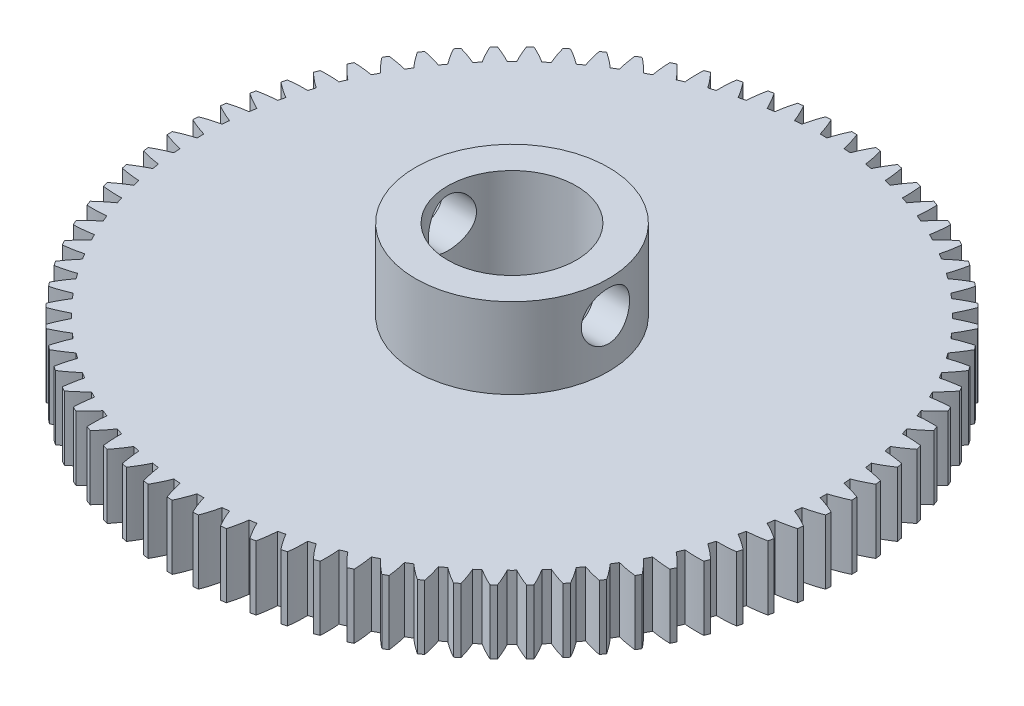
from build123d import *

# Parameters (mm, degrees)
SKETCH_1_R               = 0.4
EXTRUDE_1_DEPTH          = 4
SKETCH_2_R               = 6
EXTRUDE_2_DEPTH          = 5
SKETCH_3_R               = 4
CUT_EXTRUDE_1_DEPTH      = 31.342722335
CUT_EXTRUDE_3_DEPTH      = 31.342722335
CUT_EXTRUDE_3_DEPTH_BACK = 31.342722335
SKETCH_5_R               = 1.5


with BuildPart() as part:
    # ｽｹｯﾁ1 → ﾎﾞｽ - 押し出し1 (new body)
    with BuildSketch(Plane(origin=(0, 0, 0), x_dir=(1, 0, 0), z_dir=(0, 1, 0))):
        with BuildLine():
            ThreePointArc((-20.490007305, 0.640000509), (-19.939485125, 0.404140641), (-19.372860459, 0.210127665))
            ThreePointArc((-19.372860459, 0.210127665), (-19.374, 0), (-19.372860459, -0.210127665))
            ThreePointArc((-19.372860459, -0.210127665), (-19.939485125, -0.404140641), (-20.490007305, -0.640000509))
            ThreePointArc((-20.490007305, -0.640000509), (-20.484195243, -0.804826223), (-20.477057312, -0.969599844))
            ThreePointArc((-20.477057312, -0.969599844), (-19.909726856, -1.161539162), (-19.329626822, -1.310497202))
            ThreePointArc((-19.329626822, -1.310497202), (-19.314276424, -1.520066521), (-19.296653969, -1.729457025))
            ThreePointArc((-19.296653969, -1.729457025), (-19.846309838, -1.967328783), (-20.376629589, -2.245655045))
            ThreePointArc((-20.376629589, -2.245655045), (-20.357903368, -2.409516648), (-20.337859451, -2.573222291))
            ThreePointArc((-20.337859451, -2.573222291), (-19.757218501, -2.720057689), (-19.167219608, -2.823042418))
            ThreePointArc((-19.167219608, -2.823042418), (-19.135473911, -3.030761326), (-19.101477191, -3.238123707))
            ThreePointArc((-19.101477191, -3.238123707), (-19.630775451, -3.518387688), (-20.137623176, -3.837464372))
            ThreePointArc((-20.137623176, -3.837464372), (-20.106098248, -3.999351601), (-20.073271924, -4.160979967))
            ThreePointArc((-20.073271924, -4.160979967), (-19.482900323, -4.261806157), (-18.886640112, -4.318182638))
            ThreePointArc((-18.886640112, -4.318182638), (-18.838694838, -4.522770479), (-18.788533453, -4.726826279))
            ThreePointArc((-18.788533453, -4.726826279), (-19.294210805, -5.047754563), (-19.77446162, -5.405614455))
            ThreePointArc((-19.77446162, -5.405614455), (-19.730332347, -5.564529222), (-19.684926, -5.723083818))
            ThreePointArc((-19.684926, -5.723083818), (-19.088463586, -5.777279172), (-18.489618198, -5.786699827))
            ThreePointArc((-18.489618198, -5.786699827), (-18.425768947, -5.986895249), (-18.359752159, -6.186386396))
            ThreePointArc((-18.359752159, -6.186386396), (-18.838690934, -6.546000353), (-19.289383933, -6.940437126))
            ThreePointArc((-19.289383933, -6.940437126), (-19.232922387, -7.09539967), (-19.175215961, -7.249902954))
            ThreePointArc((-19.175215961, -7.249902954), (-18.576340124, -7.257133341), (-17.97860164, -7.219540087))
            ThreePointArc((-17.97860164, -7.219540087), (-17.899242063, -7.414108819), (-17.817776888, -7.607805384))
            ThreePointArc((-17.817776888, -7.607805384), (-18.267024268, -8.003887874), (-18.685380779, -8.432469696))
            ThreePointArc((-18.685380779, -8.432469696), (-18.616935064, -8.58252462), (-18.54728434, -8.732024027))
            ThreePointArc((-18.54728434, -8.732024027), (-17.949687347, -8.692244869), (-17.356741025, -8.607869481))
            ThreePointArc((-17.356741025, -8.607869481), (-17.2623604, -8.795611942), (-17.165949098, -8.982319721))
            ThreePointArc((-17.165949098, -8.982319721), (-17.582735324, -9.412428765), (-17.966176038, -9.872513285))
            ThreePointArc((-17.966176038, -9.872513285), (-17.886168145, -10.016735451), (-17.805002543, -10.160309269))
            ThreePointArc((-17.805002543, -10.160309269), (-17.212368779, -10.073765816), (-16.627870329, -9.943128498))
            ThreePointArc((-16.627870329, -9.943128498), (-16.519050544, -10.122887193), (-16.408287523, -10.301455071))
            ThreePointArc((-16.408287523, -10.301455071), (-16.790042969, -10.762938902), (-17.136203849, -11.251689547))
            ThreePointArc((-17.136203849, -11.251689547), (-17.045127052, -11.389189777), (-16.952946985, -11.525952825))
            ThreePointArc((-16.952946985, -11.525952825), (-16.368930234, -11.393178648), (-15.796483284, -11.217084821))
            ThreePointArc((-15.796483284, -11.217084821), (-15.673895249, -11.387751478), (-15.549463399, -11.557078524))
            ThreePointArc((-15.549463399, -11.557078524), (-15.893834417, -12.047091942), (-16.200581264, -12.561495401))
            ThreePointArc((-16.200581264, -12.561495401), (-16.098997083, -12.691425961), (-15.996370871, -12.820535049))
            ThreePointArc((-15.996370871, -12.820535049), (-15.424571791, -12.642348745), (-14.867705666, -12.421884086))
            ThreePointArc((-14.867705666, -12.421884086), (-14.732105178, -12.582406488), (-14.594771662, -12.741448746))
            ThreePointArc((-14.594771662, -12.741448746), (-14.89963509, -13.256970654), (-15.165076708, -13.793855459))
            ThreePointArc((-15.165076708, -13.793855459), (-15.053611444, -13.915415284), (-14.941171812, -14.036074412))
            ThreePointArc((-14.941171812, -14.036074412), (-14.385115733, -13.813574558), (-13.847263698, -13.550098305))
            ThreePointArc((-13.847263698, -13.550098305), (-13.699486779, -13.699486779), (-13.550098305, -13.847263698))
            ThreePointArc((-13.550098305, -13.847263698), (-13.813574558, -14.385115733), (-14.036074412, -14.941171812))
            ThreePointArc((-14.036074412, -14.941171812), (-13.915415284, -15.053611444), (-13.793855459, -15.165076708))
            ThreePointArc((-13.793855459, -15.165076708), (-13.256970654, -14.89963509), (-12.741448746, -14.594771662))
            ThreePointArc((-12.741448746, -14.594771662), (-12.582406488, -14.732105178), (-12.421884086, -14.867705666))
            ThreePointArc((-12.421884086, -14.867705666), (-12.642348745, -15.424571791), (-12.82053505, -15.996370871))
            ThreePointArc((-12.82053505, -15.996370871), (-12.691425961, -16.098997083), (-12.561495401, -16.200581264))
            ThreePointArc((-12.561495401, -16.200581264), (-12.047091942, -15.893834417), (-11.557078524, -15.549463399))
            ThreePointArc((-11.557078524, -15.549463399), (-11.387751478, -15.673895249), (-11.217084821, -15.796483284))
            ThreePointArc((-11.217084821, -15.796483284), (-11.393178648, -16.368930234), (-11.525952825, -16.952946985))
            ThreePointArc((-11.525952825, -16.952946985), (-11.389189777, -17.045127052), (-11.251689547, -17.136203849))
            ThreePointArc((-11.251689547, -17.136203849), (-10.762938902, -16.790042969), (-10.301455071, -16.408287523))
            ThreePointArc((-10.301455071, -16.408287523), (-10.122887193, -16.519050544), (-9.943128498, -16.627870329))
            ThreePointArc((-9.943128498, -16.627870329), (-10.073765816, -17.212368779), (-10.160309269, -17.805002543))
            ThreePointArc((-10.160309269, -17.805002543), (-10.016735451, -17.886168145), (-9.872513285, -17.966176039))
            ThreePointArc((-9.872513285, -17.966176039), (-9.412428765, -17.582735324), (-8.982319722, -17.165949098))
            ThreePointArc((-8.982319722, -17.165949098), (-8.795611942, -17.2623604), (-8.607869481, -17.356741025))
            ThreePointArc((-8.607869481, -17.356741025), (-8.692244869, -17.949687347), (-8.732024027, -18.54728434))
            ThreePointArc((-8.732024027, -18.54728434), (-8.58252462, -18.616935064), (-8.432469696, -18.685380779))
            ThreePointArc((-8.432469696, -18.685380779), (-8.003887874, -18.267024268), (-7.607805384, -17.817776889))
            ThreePointArc((-7.607805384, -17.817776889), (-7.414108819, -17.899242063), (-7.219540087, -17.978601641))
            ThreePointArc((-7.219540087, -17.978601641), (-7.257133341, -18.576340124), (-7.249902954, -19.175215961))
            ThreePointArc((-7.249902954, -19.175215961), (-7.09539967, -19.232922386), (-6.940437126, -19.289383932))
            ThreePointArc((-6.940437126, -19.289383932), (-6.546000353, -18.838690934), (-6.186386396, -18.359752159))
            ThreePointArc((-6.186386396, -18.359752159), (-5.986895249, -18.425768947), (-5.786699827, -18.489618198))
            ThreePointArc((-5.786699827, -18.489618198), (-5.777279172, -19.088463586), (-5.723083818, -19.684926))
            ThreePointArc((-5.723083818, -19.684926), (-5.564529222, -19.730332347), (-5.405614455, -19.77446162))
            ThreePointArc((-5.405614455, -19.77446162), (-5.047754563, -19.294210805), (-4.726826279, -18.788533453))
            ThreePointArc((-4.726826279, -18.788533453), (-4.522770479, -18.838694838), (-4.318182638, -18.886640112))
            ThreePointArc((-4.318182638, -18.886640112), (-4.261806157, -19.482900323), (-4.160979967, -20.073271924))
            ThreePointArc((-4.160979967, -20.073271924), (-3.999351601, -20.106098248), (-3.837464372, -20.137623176))
            ThreePointArc((-3.837464372, -20.137623176), (-3.518387688, -19.630775451), (-3.238123707, -19.101477191))
            ThreePointArc((-3.238123707, -19.101477191), (-3.030761326, -19.135473911), (-2.823042418, -19.167219608))
            ThreePointArc((-2.823042418, -19.167219608), (-2.720057689, -19.757218501), (-2.573222291, -20.337859451))
            ThreePointArc((-2.573222291, -20.337859451), (-2.409516648, -20.357903368), (-2.245655045, -20.376629589))
            ThreePointArc((-2.245655045, -20.376629589), (-1.967328783, -19.846309838), (-1.729457025, -19.296653969))
            ThreePointArc((-1.729457025, -19.296653969), (-1.520066521, -19.314276424), (-1.310497202, -19.329626822))
            ThreePointArc((-1.310497202, -19.329626822), (-1.161539162, -19.909726856), (-0.969599844, -20.477057312))
            ThreePointArc((-0.969599844, -20.477057312), (-0.804826223, -20.484195243), (-0.640000509, -20.490007305))
            ThreePointArc((-0.640000509, -20.490007305), (-0.404140641, -19.939485125), (-0.210127665, -19.372860459))
            ThreePointArc((-0.210127665, -19.372860459), (0, -19.374), (0.210127665, -19.372860459))
            ThreePointArc((0.210127665, -19.372860459), (0.404140641, -19.939485125), (0.640000509, -20.490007305))
            ThreePointArc((0.640000509, -20.490007305), (0.804826223, -20.484195243), (0.969599844, -20.477057312))
            ThreePointArc((0.969599844, -20.477057312), (1.161539162, -19.909726856), (1.310497202, -19.329626822))
            ThreePointArc((1.310497202, -19.329626822), (1.520066521, -19.314276424), (1.729457025, -19.296653969))
            ThreePointArc((1.729457025, -19.296653969), (1.967328783, -19.846309838), (2.245655045, -20.376629589))
            ThreePointArc((2.245655045, -20.376629589), (2.409516648, -20.357903368), (2.573222291, -20.337859451))
            ThreePointArc((2.573222291, -20.337859451), (2.720057689, -19.757218501), (2.823042418, -19.167219608))
            ThreePointArc((2.823042418, -19.167219608), (3.030761326, -19.135473911), (3.238123707, -19.101477191))
            ThreePointArc((3.238123707, -19.101477191), (3.518387688, -19.630775451), (3.837464372, -20.137623176))
            ThreePointArc((3.837464372, -20.137623176), (3.999351601, -20.106098248), (4.160979967, -20.073271924))
            ThreePointArc((4.160979967, -20.073271924), (4.261806157, -19.482900323), (4.318182638, -18.886640112))
            ThreePointArc((4.318182638, -18.886640112), (4.522770479, -18.838694838), (4.726826279, -18.788533453))
            ThreePointArc((4.726826279, -18.788533453), (5.047754563, -19.294210805), (5.405614455, -19.77446162))
            ThreePointArc((5.405614455, -19.77446162), (5.564529222, -19.730332347), (5.723083818, -19.684926))
            ThreePointArc((5.723083818, -19.684926), (5.777279172, -19.088463586), (5.786699827, -18.489618198))
            ThreePointArc((5.786699827, -18.489618198), (5.986895249, -18.425768947), (6.186386396, -18.359752159))
            ThreePointArc((6.186386396, -18.359752159), (6.546000353, -18.838690934), (6.940437126, -19.289383932))
            ThreePointArc((6.940437126, -19.289383932), (7.09539967, -19.232922386), (7.249902954, -19.175215961))
            ThreePointArc((7.249902954, -19.175215961), (7.257133341, -18.576340124), (7.219540086, -17.97860164))
            ThreePointArc((7.219540086, -17.97860164), (7.414108819, -17.899242063), (7.607805384, -17.817776888))
            ThreePointArc((7.607805384, -17.817776888), (8.003887874, -18.267024268), (8.432469695, -18.685380778))
            ThreePointArc((8.432469695, -18.685380778), (8.58252462, -18.616935063), (8.732024027, -18.54728434))
            ThreePointArc((8.732024027, -18.54728434), (8.692244869, -17.949687347), (8.607869481, -17.356741025))
            ThreePointArc((8.607869481, -17.356741025), (8.795611942, -17.2623604), (8.982319721, -17.165949098))
            ThreePointArc((8.982319721, -17.165949098), (9.412428765, -17.582735324), (9.872513285, -17.966176038))
            ThreePointArc((9.872513285, -17.966176038), (10.016735451, -17.886168145), (10.160309269, -17.805002543))
            ThreePointArc((10.160309269, -17.805002543), (10.073765816, -17.212368779), (9.943128498, -16.627870329))
            ThreePointArc((9.943128498, -16.627870329), (10.122887193, -16.519050544), (10.301455071, -16.408287523))
            ThreePointArc((10.301455071, -16.408287523), (10.762938902, -16.790042969), (11.251689547, -17.136203849))
            ThreePointArc((11.251689547, -17.136203849), (11.389189777, -17.045127052), (11.525952825, -16.952946985))
            ThreePointArc((11.525952825, -16.952946985), (11.393178648, -16.368930234), (11.217084821, -15.796483283))
            ThreePointArc((11.217084821, -15.796483283), (11.387751478, -15.673895249), (11.557078524, -15.549463399))
            ThreePointArc((11.557078524, -15.549463399), (12.047091942, -15.893834417), (12.561495401, -16.200581264))
            ThreePointArc((12.561495401, -16.200581264), (12.691425961, -16.098997083), (12.820535049, -15.996370871))
            ThreePointArc((12.820535049, -15.996370871), (12.642348745, -15.424571791), (12.421884086, -14.867705666))
            ThreePointArc((12.421884086, -14.867705666), (12.582406488, -14.732105178), (12.741448746, -14.594771662))
            ThreePointArc((12.741448746, -14.594771662), (13.256970654, -14.899635089), (13.793855459, -15.165076708))
            ThreePointArc((13.793855459, -15.165076708), (13.915415283, -15.053611443), (14.036074412, -14.941171812))
            ThreePointArc((14.036074412, -14.941171812), (13.813574557, -14.385115733), (13.550098305, -13.847263698))
            ThreePointArc((13.550098305, -13.847263698), (13.699486779, -13.699486779), (13.847263698, -13.550098305))
            ThreePointArc((13.847263698, -13.550098305), (14.385115733, -13.813574557), (14.941171812, -14.036074412))
            ThreePointArc((14.941171812, -14.036074412), (15.053611443, -13.915415283), (15.165076708, -13.793855459))
            ThreePointArc((15.165076708, -13.793855459), (14.899635089, -13.256970654), (14.594771662, -12.741448746))
            ThreePointArc((14.594771662, -12.741448746), (14.732105178, -12.582406488), (14.867705666, -12.421884086))
            ThreePointArc((14.867705666, -12.421884086), (15.424571791, -12.642348745), (15.996370871, -12.820535049))
            ThreePointArc((15.996370871, -12.820535049), (16.098997083, -12.691425961), (16.200581264, -12.561495401))
            ThreePointArc((16.200581264, -12.561495401), (15.893834417, -12.047091942), (15.549463399, -11.557078524))
            ThreePointArc((15.549463399, -11.557078524), (15.673895249, -11.387751478), (15.796483283, -11.217084821))
            ThreePointArc((15.796483283, -11.217084821), (16.368930234, -11.393178648), (16.952946985, -11.525952825))
            ThreePointArc((16.952946985, -11.525952825), (17.045127052, -11.389189777), (17.136203849, -11.251689547))
            ThreePointArc((17.136203849, -11.251689547), (16.790042969, -10.762938902), (16.408287523, -10.301455071))
            ThreePointArc((16.408287523, -10.301455071), (16.519050544, -10.122887193), (16.627870329, -9.943128498))
            ThreePointArc((16.627870329, -9.943128498), (17.212368779, -10.073765816), (17.805002543, -10.160309269))
            ThreePointArc((17.805002543, -10.160309269), (17.886168145, -10.016735451), (17.966176038, -9.872513285))
            ThreePointArc((17.966176038, -9.872513285), (17.582735324, -9.412428765), (17.165949098, -8.982319721))
            ThreePointArc((17.165949098, -8.982319721), (17.2623604, -8.795611942), (17.356741025, -8.607869481))
            ThreePointArc((17.356741025, -8.607869481), (17.949687347, -8.692244869), (18.54728434, -8.732024027))
            ThreePointArc((18.54728434, -8.732024027), (18.616935063, -8.58252462), (18.685380778, -8.432469696))
            ThreePointArc((18.685380778, -8.432469696), (18.267024268, -8.003887874), (17.817776888, -7.607805384))
            ThreePointArc((17.817776888, -7.607805384), (17.899242063, -7.414108819), (17.97860164, -7.219540086))
            ThreePointArc((17.97860164, -7.219540086), (18.576340124, -7.257133341), (19.175215961, -7.249902954))
            ThreePointArc((19.175215961, -7.249902954), (19.232922386, -7.09539967), (19.289383932, -6.940437126))
            ThreePointArc((19.289383932, -6.940437126), (18.838690934, -6.546000353), (18.359752159, -6.186386396))
            ThreePointArc((18.359752159, -6.186386396), (18.425768947, -5.986895249), (18.489618198, -5.786699827))
            ThreePointArc((18.489618198, -5.786699827), (19.088463586, -5.777279172), (19.684926, -5.723083818))
            ThreePointArc((19.684926, -5.723083818), (19.730332347, -5.564529222), (19.77446162, -5.405614455))
            ThreePointArc((19.77446162, -5.405614455), (19.294210805, -5.047754563), (18.788533453, -4.726826279))
            ThreePointArc((18.788533453, -4.726826279), (18.838694838, -4.522770479), (18.886640112, -4.318182638))
            ThreePointArc((18.886640112, -4.318182638), (19.482900323, -4.261806157), (20.073271924, -4.160979967))
            ThreePointArc((20.073271924, -4.160979967), (20.106098248, -3.999351601), (20.137623176, -3.837464372))
            ThreePointArc((20.137623176, -3.837464372), (19.630775451, -3.518387688), (19.101477191, -3.238123707))
            ThreePointArc((19.101477191, -3.238123707), (19.135473911, -3.030761326), (19.167219608, -2.823042418))
            ThreePointArc((19.167219608, -2.823042418), (19.757218501, -2.720057689), (20.337859451, -2.573222291))
            ThreePointArc((20.337859451, -2.573222291), (20.357903368, -2.409516648), (20.376629589, -2.245655045))
            ThreePointArc((20.376629589, -2.245655045), (19.846309838, -1.967328783), (19.296653969, -1.729457025))
            ThreePointArc((19.296653969, -1.729457025), (19.314276424, -1.520066521), (19.329626822, -1.310497202))
            ThreePointArc((19.329626822, -1.310497202), (19.909726856, -1.161539162), (20.477057312, -0.969599844))
            ThreePointArc((20.477057312, -0.969599844), (20.484195243, -0.804826223), (20.490007305, -0.640000509))
            ThreePointArc((20.490007305, -0.640000509), (19.939485125, -0.404140641), (19.372860459, -0.210127665))
            ThreePointArc((19.372860459, -0.210127665), (19.374, 0), (19.372860459, 0.210127665))
            ThreePointArc((19.372860459, 0.210127665), (19.939485125, 0.404140641), (20.490007305, 0.640000509))
            ThreePointArc((20.490007305, 0.640000509), (20.484195243, 0.804826223), (20.477057312, 0.969599844))
            ThreePointArc((20.477057312, 0.969599844), (19.909726856, 1.161539162), (19.329626822, 1.310497202))
            ThreePointArc((19.329626822, 1.310497202), (19.314276424, 1.520066521), (19.296653969, 1.729457025))
            ThreePointArc((19.296653969, 1.729457025), (19.846309838, 1.967328783), (20.376629589, 2.245655045))
            ThreePointArc((20.376629589, 2.245655045), (20.357903368, 2.409516648), (20.337859451, 2.573222291))
            ThreePointArc((20.337859451, 2.573222291), (19.757218501, 2.720057689), (19.167219608, 2.823042418))
            ThreePointArc((19.167219608, 2.823042418), (19.135473911, 3.030761326), (19.101477191, 3.238123707))
            ThreePointArc((19.101477191, 3.238123707), (19.630775451, 3.518387688), (20.137623176, 3.837464372))
            ThreePointArc((20.137623176, 3.837464372), (20.106098248, 3.999351601), (20.073271924, 4.160979967))
            ThreePointArc((20.073271924, 4.160979967), (19.482900323, 4.261806157), (18.886640112, 4.318182638))
            ThreePointArc((18.886640112, 4.318182638), (18.838694838, 4.522770479), (18.788533453, 4.726826279))
            ThreePointArc((18.788533453, 4.726826279), (19.294210805, 5.047754563), (19.77446162, 5.405614455))
            ThreePointArc((19.77446162, 5.405614455), (19.730332347, 5.564529222), (19.684926, 5.723083818))
            ThreePointArc((19.684926, 5.723083818), (19.088463586, 5.777279172), (18.489618198, 5.786699827))
            ThreePointArc((18.489618198, 5.786699827), (18.425768947, 5.986895249), (18.359752159, 6.186386396))
            ThreePointArc((18.359752159, 6.186386396), (18.838690934, 6.546000353), (19.289383932, 6.940437126))
            ThreePointArc((19.289383932, 6.940437126), (19.232922386, 7.09539967), (19.175215961, 7.249902954))
            ThreePointArc((19.175215961, 7.249902954), (18.576340124, 7.257133341), (17.97860164, 7.219540086))
            ThreePointArc((17.97860164, 7.219540086), (17.899242063, 7.414108819), (17.817776888, 7.607805384))
            ThreePointArc((17.817776888, 7.607805384), (18.267024268, 8.003887874), (18.685380778, 8.432469695))
            ThreePointArc((18.685380778, 8.432469695), (18.616935063, 8.58252462), (18.54728434, 8.732024027))
            ThreePointArc((18.54728434, 8.732024027), (17.949687347, 8.692244869), (17.356741025, 8.607869481))
            ThreePointArc((17.356741025, 8.607869481), (17.2623604, 8.795611942), (17.165949098, 8.982319721))
            ThreePointArc((17.165949098, 8.982319721), (17.582735324, 9.412428765), (17.966176038, 9.872513285))
            ThreePointArc((17.966176038, 9.872513285), (17.886168145, 10.016735451), (17.805002543, 10.160309269))
            ThreePointArc((17.805002543, 10.160309269), (17.212368779, 10.073765816), (16.627870329, 9.943128498))
            ThreePointArc((16.627870329, 9.943128498), (16.519050544, 10.122887193), (16.408287523, 10.301455071))
            ThreePointArc((16.408287523, 10.301455071), (16.790042969, 10.762938902), (17.136203849, 11.251689547))
            ThreePointArc((17.136203849, 11.251689547), (17.045127052, 11.389189777), (16.952946985, 11.525952825))
            ThreePointArc((16.952946985, 11.525952825), (16.368930234, 11.393178648), (15.796483283, 11.217084821))
            ThreePointArc((15.796483283, 11.217084821), (15.673895249, 11.387751478), (15.549463399, 11.557078524))
            ThreePointArc((15.549463399, 11.557078524), (15.893834417, 12.047091942), (16.200581264, 12.561495401))
            ThreePointArc((16.200581264, 12.561495401), (16.098997083, 12.691425961), (15.996370871, 12.820535049))
            ThreePointArc((15.996370871, 12.820535049), (15.424571791, 12.642348745), (14.867705666, 12.421884086))
            ThreePointArc((14.867705666, 12.421884086), (14.732105178, 12.582406488), (14.594771662, 12.741448746))
            ThreePointArc((14.594771662, 12.741448746), (14.899635089, 13.256970654), (15.165076708, 13.793855459))
            ThreePointArc((15.165076708, 13.793855459), (15.053611443, 13.915415283), (14.941171812, 14.036074412))
            ThreePointArc((14.941171812, 14.036074412), (14.385115733, 13.813574557), (13.847263698, 13.550098305))
            ThreePointArc((13.847263698, 13.550098305), (13.699486779, 13.699486779), (13.550098305, 13.847263698))
            ThreePointArc((13.550098305, 13.847263698), (13.813574557, 14.385115733), (14.036074412, 14.941171812))
            ThreePointArc((14.036074412, 14.941171812), (13.915415283, 15.053611443), (13.793855459, 15.165076708))
            ThreePointArc((13.793855459, 15.165076708), (13.256970654, 14.899635089), (12.741448746, 14.594771662))
            ThreePointArc((12.741448746, 14.594771662), (12.582406488, 14.732105178), (12.421884086, 14.867705666))
            ThreePointArc((12.421884086, 14.867705666), (12.642348745, 15.424571791), (12.820535049, 15.996370871))
            ThreePointArc((12.820535049, 15.996370871), (12.691425961, 16.098997083), (12.561495401, 16.200581264))
            ThreePointArc((12.561495401, 16.200581264), (12.047091942, 15.893834417), (11.557078524, 15.549463399))
            ThreePointArc((11.557078524, 15.549463399), (11.387751478, 15.673895249), (11.217084821, 15.796483283))
            ThreePointArc((11.217084821, 15.796483283), (11.393178648, 16.368930234), (11.525952825, 16.952946985))
            ThreePointArc((11.525952825, 16.952946985), (11.389189777, 17.045127052), (11.251689547, 17.136203849))
            ThreePointArc((11.251689547, 17.136203849), (10.762938902, 16.790042969), (10.301455071, 16.408287523))
            ThreePointArc((10.301455071, 16.408287523), (10.122887193, 16.519050544), (9.943128498, 16.627870329))
            ThreePointArc((9.943128498, 16.627870329), (10.073765816, 17.212368779), (10.160309269, 17.805002543))
            ThreePointArc((10.160309269, 17.805002543), (10.016735451, 17.886168145), (9.872513285, 17.966176038))
            ThreePointArc((9.872513285, 17.966176038), (9.412428765, 17.582735324), (8.982319721, 17.165949098))
            ThreePointArc((8.982319721, 17.165949098), (8.795611942, 17.2623604), (8.607869481, 17.356741025))
            ThreePointArc((8.607869481, 17.356741025), (8.692244869, 17.949687347), (8.732024027, 18.54728434))
            ThreePointArc((8.732024027, 18.54728434), (8.58252462, 18.616935063), (8.432469696, 18.685380778))
            ThreePointArc((8.432469696, 18.685380778), (8.003887874, 18.267024268), (7.607805384, 17.817776888))
            ThreePointArc((7.607805384, 17.817776888), (7.414108819, 17.899242063), (7.219540086, 17.97860164))
            ThreePointArc((7.219540086, 17.97860164), (7.257133341, 18.576340124), (7.249902954, 19.175215961))
            ThreePointArc((7.249902954, 19.175215961), (7.09539967, 19.232922386), (6.940437126, 19.289383932))
            ThreePointArc((6.940437126, 19.289383932), (6.546000353, 18.838690934), (6.186386396, 18.359752159))
            ThreePointArc((6.186386396, 18.359752159), (5.986895249, 18.425768947), (5.786699827, 18.489618198))
            ThreePointArc((5.786699827, 18.489618198), (5.777279172, 19.088463586), (5.723083818, 19.684926))
            ThreePointArc((5.723083818, 19.684926), (5.564529222, 19.730332347), (5.405614455, 19.77446162))
            ThreePointArc((5.405614455, 19.77446162), (5.047754563, 19.294210805), (4.726826279, 18.788533453))
            ThreePointArc((4.726826279, 18.788533453), (4.522770479, 18.838694838), (4.318182638, 18.886640112))
            ThreePointArc((4.318182638, 18.886640112), (4.261806157, 19.482900323), (4.160979967, 20.073271923))
            ThreePointArc((4.160979967, 20.073271923), (3.999351601, 20.106098248), (3.837464372, 20.137623176))
            ThreePointArc((3.837464372, 20.137623176), (3.518387688, 19.630775451), (3.238123707, 19.101477191))
            ThreePointArc((3.238123707, 19.101477191), (3.030761326, 19.135473911), (2.823042418, 19.167219608))
            ThreePointArc((2.823042418, 19.167219608), (2.720057689, 19.757218501), (2.573222291, 20.337859451))
            ThreePointArc((2.573222291, 20.337859451), (2.409516648, 20.357903368), (2.245655045, 20.376629589))
            ThreePointArc((2.245655045, 20.376629589), (1.967328783, 19.846309838), (1.729457025, 19.296653969))
            ThreePointArc((1.729457025, 19.296653969), (1.520066521, 19.314276424), (1.310497202, 19.329626822))
            ThreePointArc((1.310497202, 19.329626822), (1.161539162, 19.909726856), (0.969599844, 20.477057312))
            ThreePointArc((0.969599844, 20.477057312), (0.804826223, 20.484195243), (0.640000509, 20.490007305))
            ThreePointArc((0.640000509, 20.490007305), (0.404140641, 19.939485125), (0.210127665, 19.372860459))
            ThreePointArc((0.210127665, 19.372860459), (0, 19.374), (-0.210127665, 19.372860459))
            ThreePointArc((-0.210127665, 19.372860459), (-0.404140641, 19.939485125), (-0.640000509, 20.490007305))
            ThreePointArc((-0.640000509, 20.490007305), (-0.804826223, 20.484195243), (-0.969599844, 20.477057312))
            ThreePointArc((-0.969599844, 20.477057312), (-1.161539162, 19.909726856), (-1.310497202, 19.329626822))
            ThreePointArc((-1.310497202, 19.329626822), (-1.520066521, 19.314276424), (-1.729457025, 19.296653969))
            ThreePointArc((-1.729457025, 19.296653969), (-1.967328783, 19.846309838), (-2.245655045, 20.376629589))
            ThreePointArc((-2.245655045, 20.376629589), (-2.409516648, 20.357903368), (-2.573222291, 20.337859451))
            ThreePointArc((-2.573222291, 20.337859451), (-2.720057689, 19.757218501), (-2.823042418, 19.167219608))
            ThreePointArc((-2.823042418, 19.167219608), (-3.030761326, 19.135473911), (-3.238123707, 19.101477191))
            ThreePointArc((-3.238123707, 19.101477191), (-3.518387688, 19.630775451), (-3.837464372, 20.137623176))
            ThreePointArc((-3.837464372, 20.137623176), (-3.999351601, 20.106098248), (-4.160979967, 20.073271924))
            ThreePointArc((-4.160979967, 20.073271924), (-4.261806157, 19.482900323), (-4.318182638, 18.886640112))
            ThreePointArc((-4.318182638, 18.886640112), (-4.522770479, 18.838694838), (-4.726826279, 18.788533453))
            ThreePointArc((-4.726826279, 18.788533453), (-5.047754563, 19.294210805), (-5.405614455, 19.77446162))
            ThreePointArc((-5.405614455, 19.77446162), (-5.564529222, 19.730332347), (-5.723083818, 19.684926))
            ThreePointArc((-5.723083818, 19.684926), (-5.777279172, 19.088463586), (-5.786699827, 18.489618198))
            ThreePointArc((-5.786699827, 18.489618198), (-5.986895249, 18.425768947), (-6.186386396, 18.359752159))
            ThreePointArc((-6.186386396, 18.359752159), (-6.546000353, 18.838690934), (-6.940437126, 19.289383933))
            ThreePointArc((-6.940437126, 19.289383933), (-7.09539967, 19.232922386), (-7.249902954, 19.175215961))
            ThreePointArc((-7.249902954, 19.175215961), (-7.257133341, 18.576340124), (-7.219540086, 17.97860164))
            ThreePointArc((-7.219540086, 17.97860164), (-7.414108819, 17.899242063), (-7.607805384, 17.817776888))
            ThreePointArc((-7.607805384, 17.817776888), (-8.003887874, 18.267024268), (-8.432469695, 18.685380778))
            ThreePointArc((-8.432469695, 18.685380778), (-8.582524619, 18.616935063), (-8.732024027, 18.54728434))
            ThreePointArc((-8.732024027, 18.54728434), (-8.692244868, 17.949687347), (-8.607869481, 17.356741025))
            ThreePointArc((-8.607869481, 17.356741025), (-8.795611942, 17.262360399), (-8.982319721, 17.165949097))
            ThreePointArc((-8.982319721, 17.165949097), (-9.412428764, 17.582735324), (-9.872513285, 17.966176038))
            ThreePointArc((-9.872513285, 17.966176038), (-10.016735451, 17.886168145), (-10.160309269, 17.805002543))
            ThreePointArc((-10.160309269, 17.805002543), (-10.073765816, 17.212368779), (-9.943128498, 16.627870329))
            ThreePointArc((-9.943128498, 16.627870329), (-10.122887193, 16.519050544), (-10.301455071, 16.408287522))
            ThreePointArc((-10.301455071, 16.408287522), (-10.762938902, 16.790042969), (-11.251689547, 17.136203848))
            ThreePointArc((-11.251689547, 17.136203848), (-11.389189777, 17.045127052), (-11.525952825, 16.952946985))
            ThreePointArc((-11.525952825, 16.952946985), (-11.393178648, 16.368930234), (-11.217084821, 15.796483283))
            ThreePointArc((-11.217084821, 15.796483283), (-11.387751478, 15.673895249), (-11.557078524, 15.549463398))
            ThreePointArc((-11.557078524, 15.549463398), (-12.047091942, 15.893834416), (-12.561495401, 16.200581264))
            ThreePointArc((-12.561495401, 16.200581264), (-12.691425961, 16.098997083), (-12.820535049, 15.996370871))
            ThreePointArc((-12.820535049, 15.996370871), (-12.642348745, 15.424571791), (-12.421884086, 14.867705665))
            ThreePointArc((-12.421884086, 14.867705665), (-12.582406488, 14.732105177), (-12.741448745, 14.594771662))
            ThreePointArc((-12.741448745, 14.594771662), (-13.256970654, 14.899635089), (-13.793855459, 15.165076708))
            ThreePointArc((-13.793855459, 15.165076708), (-13.915415283, 15.053611443), (-14.036074412, 14.941171811))
            ThreePointArc((-14.036074412, 14.941171811), (-13.813574557, 14.385115733), (-13.550098305, 13.847263698))
            ThreePointArc((-13.550098305, 13.847263698), (-13.699486779, 13.699486779), (-13.847263698, 13.550098305))
            ThreePointArc((-13.847263698, 13.550098305), (-14.385115733, 13.813574557), (-14.941171811, 14.036074412))
            ThreePointArc((-14.941171811, 14.036074412), (-15.053611443, 13.915415283), (-15.165076708, 13.793855459))
            ThreePointArc((-15.165076708, 13.793855459), (-14.899635089, 13.256970654), (-14.594771662, 12.741448745))
            ThreePointArc((-14.594771662, 12.741448745), (-14.732105177, 12.582406488), (-14.867705665, 12.421884086))
            ThreePointArc((-14.867705665, 12.421884086), (-15.424571791, 12.642348745), (-15.996370871, 12.820535049))
            ThreePointArc((-15.996370871, 12.820535049), (-16.098997083, 12.691425961), (-16.200581264, 12.561495401))
            ThreePointArc((-16.200581264, 12.561495401), (-15.893834417, 12.047091942), (-15.549463398, 11.557078524))
            ThreePointArc((-15.549463398, 11.557078524), (-15.673895249, 11.387751478), (-15.796483283, 11.217084821))
            ThreePointArc((-15.796483283, 11.217084821), (-16.368930234, 11.393178648), (-16.952946985, 11.525952825))
            ThreePointArc((-16.952946985, 11.525952825), (-17.045127052, 11.389189777), (-17.136203849, 11.251689547))
            ThreePointArc((-17.136203849, 11.251689547), (-16.790042969, 10.762938902), (-16.408287522, 10.301455071))
            ThreePointArc((-16.408287522, 10.301455071), (-16.519050544, 10.122887193), (-16.627870329, 9.943128498))
            ThreePointArc((-16.627870329, 9.943128498), (-17.212368779, 10.073765816), (-17.805002543, 10.160309269))
            ThreePointArc((-17.805002543, 10.160309269), (-17.886168145, 10.016735451), (-17.966176038, 9.872513285))
            ThreePointArc((-17.966176038, 9.872513285), (-17.582735324, 9.412428765), (-17.165949098, 8.982319721))
            ThreePointArc((-17.165949098, 8.982319721), (-17.2623604, 8.795611942), (-17.356741025, 8.607869481))
            ThreePointArc((-17.356741025, 8.607869481), (-17.949687347, 8.692244869), (-18.54728434, 8.732024027))
            ThreePointArc((-18.54728434, 8.732024027), (-18.616935063, 8.582524619), (-18.685380778, 8.432469695))
            ThreePointArc((-18.685380778, 8.432469695), (-18.267024268, 8.003887874), (-17.817776888, 7.607805384))
            ThreePointArc((-17.817776888, 7.607805384), (-17.899242063, 7.414108819), (-17.97860164, 7.219540086))
            ThreePointArc((-17.97860164, 7.219540086), (-18.576340124, 7.257133341), (-19.175215961, 7.249902954))
            ThreePointArc((-19.175215961, 7.249902954), (-19.232922386, 7.09539967), (-19.289383932, 6.940437126))
            ThreePointArc((-19.289383932, 6.940437126), (-18.838690934, 6.546000353), (-18.359752159, 6.186386396))
            ThreePointArc((-18.359752159, 6.186386396), (-18.425768947, 5.986895249), (-18.489618198, 5.786699827))
            ThreePointArc((-18.489618198, 5.786699827), (-19.088463586, 5.777279172), (-19.684926, 5.723083818))
            ThreePointArc((-19.684926, 5.723083818), (-19.730332347, 5.564529222), (-19.77446162, 5.405614455))
            ThreePointArc((-19.77446162, 5.405614455), (-19.294210805, 5.047754563), (-18.788533453, 4.726826279))
            ThreePointArc((-18.788533453, 4.726826279), (-18.838694838, 4.522770479), (-18.886640112, 4.318182638))
            ThreePointArc((-18.886640112, 4.318182638), (-19.482900323, 4.261806157), (-20.073271923, 4.160979967))
            ThreePointArc((-20.073271923, 4.160979967), (-20.106098248, 3.999351601), (-20.137623176, 3.837464372))
            ThreePointArc((-20.137623176, 3.837464372), (-19.630775451, 3.518387688), (-19.10147719, 3.238123707))
            ThreePointArc((-19.10147719, 3.238123707), (-19.135473911, 3.030761326), (-19.167219608, 2.823042418))
            ThreePointArc((-19.167219608, 2.823042418), (-19.757218501, 2.720057689), (-20.337859451, 2.573222291))
            ThreePointArc((-20.337859451, 2.573222291), (-20.357903368, 2.409516648), (-20.376629589, 2.245655045))
            ThreePointArc((-20.376629589, 2.245655045), (-19.846309838, 1.967328783), (-19.296653969, 1.729457025))
            ThreePointArc((-19.296653969, 1.729457025), (-19.314276424, 1.520066521), (-19.329626822, 1.310497202))
            ThreePointArc((-19.329626822, 1.310497202), (-19.909726856, 1.161539162), (-20.477057312, 0.969599844))
            ThreePointArc((-20.477057312, 0.969599844), (-20.484195243, 0.804826223), (-20.490007305, 0.640000509))
        make_face()
        Circle(SKETCH_1_R, mode=Mode.SUBTRACT)
    extrude(amount=EXTRUDE_1_DEPTH)

    # ｽｹｯﾁ2 → ﾎﾞｽ - 押し出し2 (add)
    with BuildSketch(Plane(origin=(0, 4, 0), x_dir=(1, 0, 0), z_dir=(0, 1, 0))):
        Circle(SKETCH_2_R)
    extrude(amount=EXTRUDE_2_DEPTH)

    # ｽｹｯﾁ3 → ｶｯﾄ - 押し出し1 (cut, through all)
    with BuildSketch(Plane(origin=(0, 9, 0), x_dir=(1, 0, 0), z_dir=(0, 1, 0))):
        Circle(SKETCH_3_R)
    extrude(amount=-CUT_EXTRUDE_1_DEPTH, mode=Mode.SUBTRACT)

    # ｽｹｯﾁ5 → ｶｯﾄ - 押し出し3 (cut, two sides: drawn at the far end of the back side and taken through both)
    with BuildSketch(Plane(origin=(0, 0, 0), x_dir=(0, 0, -1), z_dir=(1, 0, 0)).offset(-CUT_EXTRUDE_3_DEPTH_BACK)):
        with Locations((0, 7)):
            Circle(SKETCH_5_R)
    extrude(amount=CUT_EXTRUDE_3_DEPTH + CUT_EXTRUDE_3_DEPTH_BACK, mode=Mode.SUBTRACT)


solid = part.part
